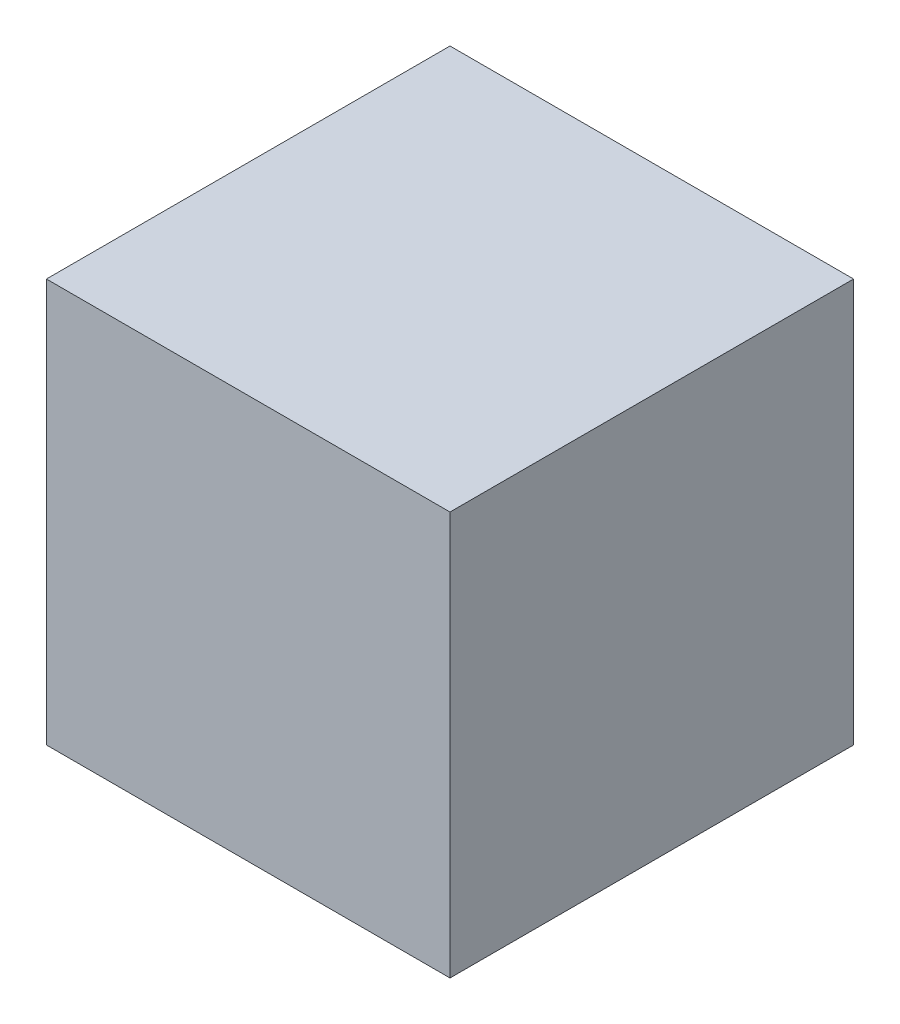
from build123d import *

# Parameters (mm, degrees)
BOSS_EXTRUDE6_DEPTH      = 51
BOSS_EXTRUDE6_DEPTH_BACK = 51
SKETCH10_W               = 102
SKETCH10_H               = 102


with BuildPart() as part:
    # Sketch10 → Boss-Extrude6 (new, two sides: drawn at the far end of the back side and taken through both)
    with BuildSketch(Plane(origin=(0, 0, 0), x_dir=(1, 0, 0), z_dir=(0, 1, 0)).offset(-BOSS_EXTRUDE6_DEPTH_BACK)):
        Rectangle(SKETCH10_W, SKETCH10_H)
    extrude(amount=BOSS_EXTRUDE6_DEPTH + BOSS_EXTRUDE6_DEPTH_BACK)


solid = part.part
